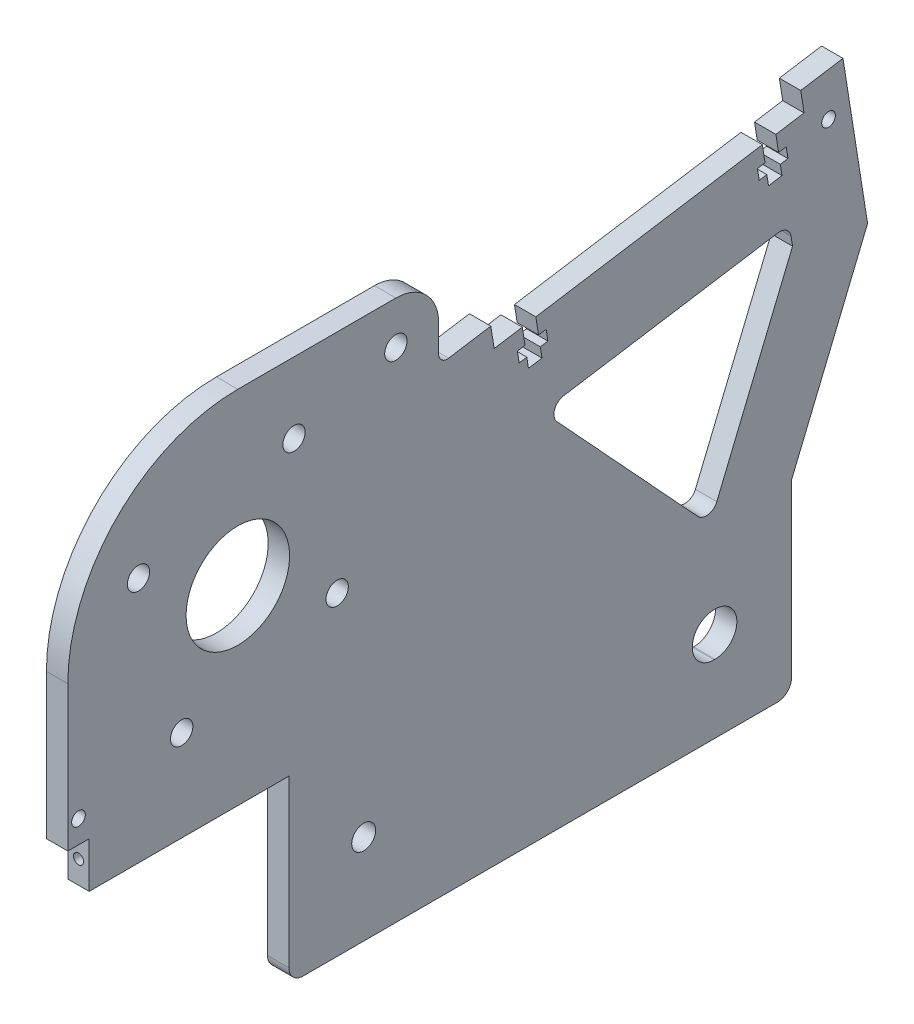
from build123d import *

# Parameters (mm, degrees)
SKETCH1_R           = 2.4892
SKETCH1_R_2         = 2.667
SKETCH1_R_3         = 1.524
SKETCH1_R_4         = 11.522750336
BOSS_EXTRUDE1_DEPTH = 4.7625
SKETCH2_R           = 1.1303
CUT_EXTRUDE1_DEPTH  = 6.35


with BuildPart() as part:
    # Sketch1 → Boss-Extrude1 (new body)
    with BuildSketch(Plane(origin=(0, 0, 0), x_dir=(0, 0, -1), z_dir=(1, 0, 0))):
        with BuildLine():
            Line((-28.170295117, 0), (77.382795117, 0))
            ThreePointArc((77.382795117, 0), (79.627859148, 0.92993597), (80.557795117, 3.175))
            Line((80.557795117, 3.175), (80.557795117, 41.307035595))
            Line((80.557795117, 41.307035595), (97.47645297, 82.259613252))
            Line((97.47645297, 82.259613252), (92.000706017, 116.832118869))
            Line((92.000706017, 116.832118869), (82.592974573, 115.342080589))
            Line((82.592974573, 115.342080589), (83.337993713, 110.638214867))
            Line((83.337993713, 110.638214867), (77.06617275, 109.644856014))
            Line((77.06617275, 109.644856014), (77.667154856, 105.850404332))
            Line((77.667154856, 105.850404332), (79.360546516, 106.118611222))
            Line((79.360546516, 106.118611222), (79.752923263, 103.641241942))
            Line((79.752923263, 103.641241942), (78.059531603, 103.373035051))
            Line((78.059531603, 103.373035051), (78.432041173, 101.02110219))
            Line((78.432041173, 101.02110219), (75.421567111, 100.544289941))
            Line((75.421567111, 100.544289941), (75.049057541, 102.896222802))
            Line((75.049057541, 102.896222802), (73.355665881, 102.628015911))
            Line((73.355665881, 102.628015911), (72.963289134, 105.105385192))
            Line((72.963289134, 105.105385192), (74.656680794, 105.373592082))
            Line((74.656680794, 105.373592082), (74.055698688, 109.168043765))
            Line((74.055698688, 109.168043765), (23.630258147, 101.181438586))
            Line((23.630258147, 101.181438586), (24.231240253, 97.386986904))
            Line((24.231240253, 97.386986904), (25.924631913, 97.655193794))
            Line((25.924631913, 97.655193794), (26.31700866, 95.177824514))
            Line((26.31700866, 95.177824514), (24.623617, 94.909617624))
            Line((24.623617, 94.909617624), (24.99612657, 92.557684763))
            Line((24.99612657, 92.557684763), (21.985652508, 92.080872513))
            Line((21.985652508, 92.080872513), (21.613142938, 94.432805374))
            Line((21.613142938, 94.432805374), (19.919751278, 94.164598484))
            Line((19.919751278, 94.164598484), (19.527374531, 96.641967764))
            Line((19.527374531, 96.641967764), (21.220766191, 96.910174654))
            Line((21.220766191, 96.910174654), (20.619784085, 100.704626337))
            Line((20.619784085, 100.704626337), (14.347963122, 99.711267484))
            Line((14.347963122, 99.711267484), (13.602943983, 104.415133206))
            Line((13.602943983, 104.415133206), (4.195212538, 102.925094927))
            ThreePointArc((4.195212538, 102.925094927), (2.66000635, 103.358067851), (1.992204883, 104.806641215))
            Line((1.992204883, 104.806641215), (1.992204883, 110.875))
            ThreePointArc((1.992204883, 110.875), (-0.797603027, 117.610192091), (-7.532795117, 120.4))
            Line((-7.532795117, 120.4), (-42.707795117, 120.4))
            ThreePointArc((-42.707795117, 120.4), (-69.471786785, 109.313991668), (-80.557795117, 82.55))
            Line((-80.557795117, 82.55), (-80.557795117, 50.292))
            Line((-80.557795117, 50.292), (-75.795295117, 50.292))
            Line((-75.795295117, 50.292), (-75.795295117, 40.132))
            Line((-75.795295117, 40.132), (-31.345295117, 40.132))
            Line((-31.345295117, 40.132), (-31.345295117, 3.175))
            ThreePointArc((-31.345295117, 3.175), (-30.415359148, 0.92993597), (-28.170295117, 0))
        make_face()
        with Locations((-55.209041359, 60.43939525)):
            Circle(SKETCH1_R, mode=Mode.SUBTRACT)
        with Locations((-14.692204883, 20.066)):
            Circle(SKETCH1_R_2, mode=Mode.SUBTRACT)
        with Locations((-20.597190367, 70.048753759)):
            Circle(SKETCH1_R, mode=Mode.SUBTRACT)
        with Locations((-64.818399868, 95.051246241)):
            Circle(SKETCH1_R, mode=Mode.SUBTRACT)
        with Locations((-30.206548876, 104.66060475)):
            Circle(SKETCH1_R, mode=Mode.SUBTRACT)
        with Locations((-78.176545117, 55.372)):
            Circle(SKETCH1_R_3, mode=Mode.SUBTRACT)
        with Locations((-42.707795117, 82.55)):
            Circle(SKETCH1_R_4, mode=Mode.SUBTRACT)
        with Locations((-7.532795117, 110.875)):
            Circle(SKETCH1_R, mode=Mode.SUBTRACT)
        with Locations((88.786878575, 106.679368285)):
            Circle(SKETCH1_R_3, mode=Mode.SUBTRACT)
        with BuildLine():
            Line((63.539795117, 15.2273), (63.285795117, 15.2273))
            ThreePointArc((63.285795117, 15.2273), (58.447095117, 20.066), (63.285795117, 24.9047))
            Line((63.285795117, 24.9047), (63.539795117, 24.9047))
            ThreePointArc((63.539795117, 24.9047), (68.378495117, 20.066), (63.539795117, 15.2273))
        make_face(mode=Mode.SUBTRACT)
        with BuildLine():
            Line((80.44359285, 88.320664741), (80.774519188, 86.231278073))
            Line((80.774519188, 86.231278073), (63.913077429, 45.417195238))
            ThreePointArc((63.913077429, 45.417195238), (62.012477448, 43.886669197), (59.69934146, 44.663967177))
            Line((59.69934146, 44.663967177), (28.32965855, 78.639134195))
            ThreePointArc((28.32965855, 78.639134195), (27.796275371, 81.195081352), (29.798497, 82.870930999))
            Line((29.798497, 82.870930999), (77.537520924, 90.432049584))
            ThreePointArc((77.537520924, 90.432049584), (79.427839006, 89.978224365), (80.44359285, 88.320664741))
        make_face(mode=Mode.SUBTRACT)
    extrude(amount=BOSS_EXTRUDE1_DEPTH)

    # Sketch2 → Cut-Extrude1 (cut)
    with BuildSketch(Plane.XY.offset(75.795295117)):
        with Locations((2.38125, 45.212)):
            Circle(SKETCH2_R)
    extrude(amount=-CUT_EXTRUDE1_DEPTH, mode=Mode.SUBTRACT)


solid = part.part
